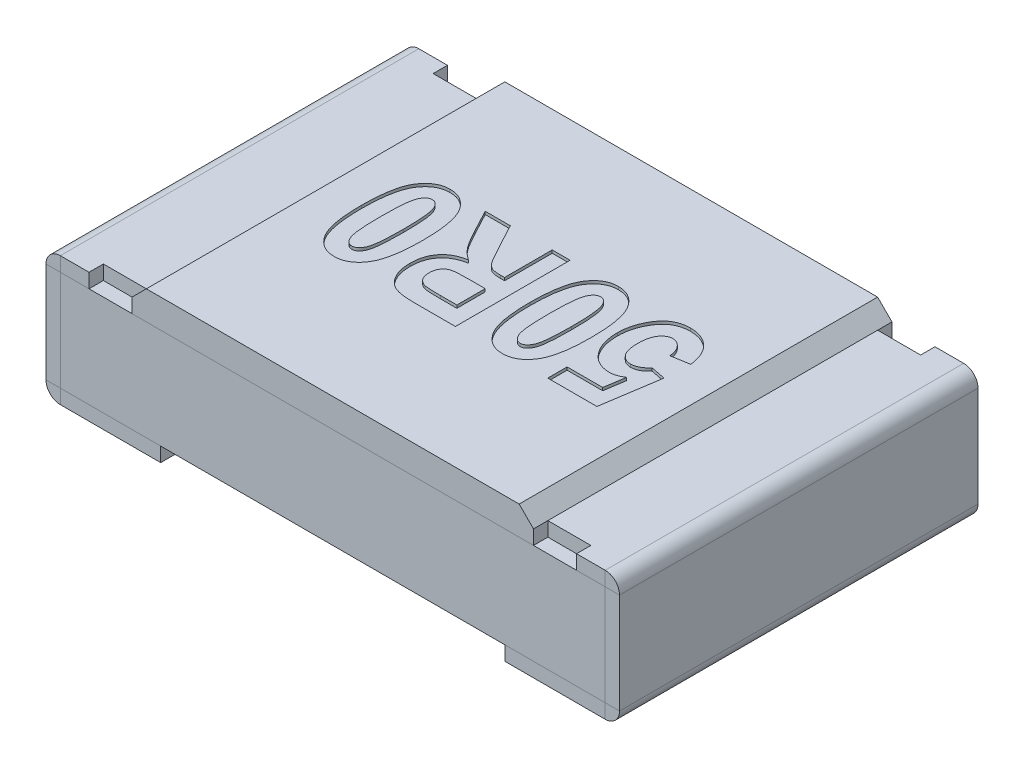
from build123d import *

# Parameters (mm, degrees)
SKETCH1_W              = 1.9
SKETCH1_H              = 1.25
BOSS_EXTRUDE1_DEPTH    = 0.35
SKETCH2_W              = 0.35
SKETCH2_H              = 1.25
BASE_FLANGE1_DEPTH     = 0.05
SM_START               = -0.625
SM_EDGE_FLANGE_1_DEPTH = 1.25
SM_EDGE_FLANGE_2_DEPTH = 1.25
SKETCH14_W             = 0.15
SKETCH14_H             = 0.05
CUT_EXTRUDE1_DEPTH     = 0.05
SKETCH17_W             = 1.4
SKETCH17_H             = 1.25
BOSS_EXTRUDE3_DEPTH    = 0.1
CHAMFER1_SIZE          = 0.05
CUT_EXTRUDE2_DEPTH     = 0.01


# Read off the part's stored shape, not the designer's step: Ребро-кромка1, Ребро-кромка2
# Sheet-metal steps are written as plain solids
with BuildPart() as part:
    # Sketch1 → Boss-Extrude1 (new body)
    with BuildSketch(Plane(origin=(0, 0.05, 0), x_dir=(1, 0, 0), z_dir=(0, 1, 0))):
        Rectangle(SKETCH1_W, SKETCH1_H)
    extrude(amount=BOSS_EXTRUDE1_DEPTH)


with BuildPart() as body_2:
    # Sketch2 → Base-Flange1 (new body)
    with BuildSketch(Plane(origin=(0, 0.05, 0), x_dir=(1, 0, 0), z_dir=(0, 1, 0))):
        with Locations((0.775, 0)):
            Rectangle(SKETCH2_W, SKETCH2_H)
    extrude(amount=-BASE_FLANGE1_DEPTH)

    # Ребро-кромка1 outline → Ребро-кромка1 (add)
    with BuildSketch(Plane.XY.offset(SM_START)):
        with BuildLine():
            Line((0.95, 0.4), (0.95, 0))
            ThreePointArc((0.95, 0), (0.985355339, 0.014644661), (1, 0.05))
            Line((1, 0.05), (1, 0.4))
            Line((1, 0.4), (0.95, 0.4))
        make_face()
    extrude(amount=SM_EDGE_FLANGE_1_DEPTH)

    # Ребро-кромка2 outline → Ребро-кромка2 (add)
    with BuildSketch(Plane.XY.offset(SM_START)):
        with BuildLine():
            Line((0.7, 0.4), (1, 0.4))
            ThreePointArc((1, 0.4), (0.985355339, 0.435355339), (0.95, 0.45))
            Line((0.95, 0.45), (0.7, 0.45))
            Line((0.7, 0.45), (0.7, 0.4))
        make_face()
    extrude(amount=SM_EDGE_FLANGE_2_DEPTH)

    # Sketch14 → Cut-Extrude1 (cut)
    with BuildSketch(Plane(origin=(0, 0.45, 0), x_dir=(1, 0, 0), z_dir=(0, 1, 0))):
        with Locations((0.775, -0.6)):
            Rectangle(SKETCH14_W, SKETCH14_H)
        with Locations((0.775, 0.6)):
            Rectangle(SKETCH14_W, SKETCH14_H)
    extrude(amount=-CUT_EXTRUDE1_DEPTH, mode=Mode.SUBTRACT)


with BuildPart() as body_3:
    # Mirror1: mirrored copy
    add(body_2.part.mirror(Plane(origin=(0, 0, 0), x_dir=(0, 0, 1), z_dir=(1, 0, 0))))


with BuildPart() as body_4:
    # Sketch17 → Boss-Extrude3 (new body)
    with BuildSketch(Plane(origin=(0, 0.4, 0), x_dir=(1, 0, 0), z_dir=(0, 1, 0))):
        Rectangle(SKETCH17_W, SKETCH17_H)
    extrude(amount=BOSS_EXTRUDE3_DEPTH)

    # Chamfer1
    chamfer1_edges = [body_4.edges().sort_by_distance(p)[0] for p in [
        (-0.7, 0.5, 0),
        (0.7, 0.5, 0),
    ]]
    chamfer(chamfer1_edges, length=CHAMFER1_SIZE)

    # Sketch18<2> → Cut-Extrude2 (cut)
    # profile 1 of 4: a face of its own
    with BuildSketch(Plane(origin=(0, 0.5, 0), x_dir=(1, 0, 0), z_dir=(0, 1, 0))):
        with BuildLine():
            Line((0.527272727, 0.096103896), (0.464935065, 0.085714286))
            add(Edge.make_bspline(
                [(0.464935065, 0.085714286), (0.464404029, 0.08993042), (0.463385582, 0.098016327), (0.460031899, 0.109328044), (0.45532733, 0.119294011), (0.449154724, 0.127597532), (0.442206893, 0.134269337), (0.434810624, 0.13924373), (0.426899303, 0.142268259), (0.421452724, 0.142661839), (0.41875, 0.142857143)],
                knots=[0, 0, 0, 0, 1.268086323, 2.431997149, 3.509560521, 4.544454025, 5.50515844, 6.375210959, 7.193740524, 8, 8, 8, 8], degree=3))
            add(Edge.make_bspline(
                [(0.41875, 0.142857143), (0.417148682, 0.1427933), (0.414001972, 0.142667844), (0.409374925, 0.141709717), (0.404892792, 0.140301963), (0.40063133, 0.138095522), (0.396490384, 0.135449466), (0.392544559, 0.132141929), (0.388838717, 0.128212088), (0.385227538, 0.123759771), (0.38200639, 0.118631701), (0.379129833, 0.112878294), (0.376721855, 0.106484491), (0.374797432, 0.099439055), (0.373238691, 0.091796533), (0.372240282, 0.083516747), (0.37156874, 0.074605143), (0.371476477, 0.068453751), (0.371428571, 0.06525974)],
                knots=[0, 0, 0, 0, 0.759915694, 1.493291328, 2.23695261, 2.984047812, 3.764651827, 4.567572245, 5.421908294, 6.327020061, 7.285992678, 8.291697758, 9.377615963, 10.524980024, 11.757348812, 13.078695297, 14.4831595, 16, 16, 16, 16], degree=3))
            add(Edge.make_bspline(
                [(0.371428571, 0.06525974), (0.371477976, 0.062255155), (0.371573788, 0.056428178), (0.372232351, 0.048001772), (0.373245247, 0.040155092), (0.374794781, 0.032943349), (0.376717763, 0.026299429), (0.379146775, 0.020292079), (0.382004988, 0.014880486), (0.385253928, 0.01004611), (0.388896956, 0.005869037), (0.392774771, 0.002207529), (0.396898992, -0.000850603), (0.401255852, -0.003437979), (0.405882881, -0.005367844), (0.41073677, -0.006734878), (0.415789557, -0.007703589), (0.419259359, -0.007762347), (0.421022727, -0.007792208)],
                knots=[0, 0, 0, 0, 1.4527188, 2.817347391, 4.084757471, 5.275362278, 6.380605517, 7.425263609, 8.402626915, 9.335182261, 10.234855237, 11.077146481, 11.909215365, 12.712502281, 13.521627502, 14.324914418, 15.14871409, 16, 16, 16, 16], degree=3))
            add(Edge.make_bspline(
                [(0.421022727, -0.007792208), (0.423273973, -0.007715286), (0.427755528, -0.007562156), (0.434381048, -0.006291246), (0.440839625, -0.004253285), (0.447128812, -0.001379947), (0.453242654, 0.002310266), (0.459181294, 0.006787381), (0.464900835, 0.012134246), (0.46845674, 0.016122951), (0.470292208, 0.018181818)],
                knots=[0, 0, 0, 0, 0.937869113, 1.867016208, 2.801624103, 3.755632097, 4.742157478, 5.773077042, 6.850519244, 8, 8, 8, 8], degree=3))
            Line((0.470292208, 0.018181818), (0.522077922, 0.007792208))
            Line((0.522077922, 0.007792208), (0.490909091, -0.194805195))
            Line((0.490909091, -0.194805195), (0.319480519, -0.194805195))
            Line((0.319480519, -0.194805195), (0.319480519, -0.127272727))
            Line((0.319480519, -0.127272727), (0.443587662, -0.127272727))
            Line((0.443587662, -0.127272727), (0.454707792, -0.055032468))
            add(Edge.make_bspline(
                [(0.454707792, -0.055032468), (0.451004373, -0.057332298), (0.443833797, -0.061785238), (0.432372216, -0.066529381), (0.420852046, -0.069532651), (0.413085487, -0.069932549), (0.409253247, -0.07012987)],
                knots=[0, 0, 0, 0, 1.075603596, 2.082587945, 3.053894447, 4, 4, 4, 4], degree=3))
            add(Edge.make_bspline(
                [(0.409253247, -0.07012987), (0.40589192, -0.070043719), (0.399298693, -0.069874733), (0.389629183, -0.068319954), (0.380294116, -0.066021692), (0.371387908, -0.06257549), (0.362837789, -0.058235723), (0.3547368, -0.052918525), (0.346905589, -0.046750579), (0.342235282, -0.041914146), (0.339853896, -0.039448052)],
                knots=[0, 0, 0, 0, 1.031196759, 2.022688252, 2.999774745, 3.977814063, 4.947386575, 5.938077482, 6.948626928, 8, 8, 8, 8], degree=3))
            add(Edge.make_bspline(
                [(0.339853896, -0.039448052), (0.336962206, -0.036126803), (0.331185175, -0.029491599), (0.323898513, -0.018417995), (0.317699294, -0.006615782), (0.312691484, 0.005969755), (0.308627341, 0.019280225), (0.305982787, 0.033440145), (0.304194913, 0.048330997), (0.303997096, 0.05851717), (0.303896104, 0.063717532)],
                knots=[0, 0, 0, 0, 0.94374017, 1.88540791, 2.835550974, 3.799054059, 4.786896658, 5.815859071, 6.884927323, 8, 8, 8, 8], degree=3))
            add(Edge.make_bspline(
                [(0.303896104, 0.063717532), (0.3039939, 0.068077365), (0.304188157, 0.076737499), (0.305615039, 0.089566861), (0.307861339, 0.102167819), (0.311162625, 0.114455722), (0.315143773, 0.126565494), (0.320392966, 0.138254931), (0.326254911, 0.149818125), (0.333090628, 0.160935278), (0.340755276, 0.171273273), (0.349327717, 0.180392394), (0.358737849, 0.18808988), (0.368949888, 0.194428113), (0.380031512, 0.199185029), (0.391806609, 0.202742948), (0.40442277, 0.204755721), (0.413088333, 0.205045958), (0.417532468, 0.205194805)],
                knots=[0, 0, 0, 0, 1.033233977, 2.052360067, 3.056176897, 4.064164219, 5.066012457, 6.07402018, 7.097977615, 8.137402717, 9.163506794, 10.143397573, 11.095939341, 12.037471958, 12.982318613, 13.946106532, 14.946660776, 16, 16, 16, 16], degree=3))
            add(Edge.make_bspline(
                [(0.417532468, 0.205194805), (0.421136239, 0.20513508), (0.428236287, 0.20501741), (0.438654966, 0.203540873), (0.448643751, 0.201416176), (0.458178119, 0.19831034), (0.467189776, 0.194195213), (0.47584476, 0.189344114), (0.483996269, 0.183536741), (0.491623392, 0.176865076), (0.49869227, 0.169413375), (0.505035357, 0.161162728), (0.510702323, 0.152198929), (0.515426624, 0.142376708), (0.5196301, 0.131909315), (0.522872767, 0.120629855), (0.525650161, 0.108670089), (0.526722607, 0.100364382), (0.527272727, 0.096103896)],
                knots=[0, 0, 0, 0, 1.008787239, 1.987483963, 2.941960961, 3.86715834, 4.789899755, 5.713107995, 6.642672678, 7.588138984, 8.547868068, 9.515110056, 10.499309066, 11.512840357, 12.564236465, 13.655396696, 14.797315056, 16, 16, 16, 16], degree=3))
        make_face()
    # profile 2 of 4: a face of its own
    with BuildSketch(Plane(origin=(0, 0.5, 0), x_dir=(1, 0, 0), z_dir=(0, 1, 0))):
        with BuildLine():
            add(Edge.make_bspline(
                [(0.166396104, -0.2), (0.162517357, -0.199857434), (0.15486375, -0.19957612), (0.143696926, -0.197413383), (0.133066146, -0.193899722), (0.123044858, -0.188915172), (0.113626938, -0.182495134), (0.104788727, -0.174678766), (0.096523296, -0.165469418), (0.08877749, -0.154784436), (0.081816853, -0.142287813), (0.075871999, -0.127754663), (0.070879301, -0.111134807), (0.066810979, -0.092430259), (0.063583701, -0.071614446), (0.061398147, -0.048685459), (0.060006663, -0.023664395), (0.059831387, -0.006279065), (0.05974026, 0.00275974)],
                knots=[0, 0, 0, 0, 0.727503026, 1.435521033, 2.125933754, 2.823035237, 3.52857293, 4.258887692, 5.031802202, 5.846339271, 6.730577678, 7.709342118, 8.787052798, 9.983216815, 11.298799232, 12.737663191, 14.303878888, 16, 16, 16, 16], degree=3))
            add(Edge.make_bspline(
                [(0.05974026, 0.00275974), (0.059831587, 0.011771451), (0.060007226, 0.029102634), (0.061395604, 0.054043203), (0.063593433, 0.076915874), (0.066794493, 0.097683332), (0.070911643, 0.116374335), (0.075833954, 0.132990657), (0.081840987, 0.147499029), (0.088769985, 0.159984707), (0.096530162, 0.170634273), (0.10470559, 0.179898955), (0.113548238, 0.187689606), (0.122948169, 0.194085522), (0.132920462, 0.199116834), (0.143487109, 0.20257983), (0.154589499, 0.204786725), (0.162191751, 0.205056917), (0.166071429, 0.205194805)],
                knots=[0, 0, 0, 0, 1.695059366, 3.259911835, 4.697127445, 6.015833273, 7.209868934, 8.295006778, 9.271397414, 10.15773515, 10.974206064, 11.745554658, 12.477603308, 13.184816065, 13.879016739, 14.571068615, 15.270769761, 16, 16, 16, 16], degree=3))
            add(Edge.make_bspline(
                [(0.166071429, 0.205194805), (0.169948166, 0.205042453), (0.177592858, 0.204742025), (0.18878376, 0.202721873), (0.199376519, 0.199148087), (0.209447857, 0.19429561), (0.218811854, 0.187842178), (0.22768016, 0.180126252), (0.235950001, 0.170995059), (0.242243926, 0.162318013), (0.246974951, 0.154643874), (0.250275534, 0.148225461), (0.253351711, 0.141273959), (0.256312839, 0.133828826), (0.258849609, 0.125744214), (0.261299278, 0.117174056), (0.263482444, 0.10807297), (0.265411661, 0.098427606), (0.267233901, 0.088263723), (0.268625076, 0.077500558), (0.269985875, 0.066254389), (0.270891486, 0.054416131), (0.271738413, 0.042080629), (0.272260378, 0.029169507), (0.272729031, 0.015750096), (0.272727865, 0.006602198), (0.272727273, 0.001948052)],
                knots=[0, 0, 0, 0, 1.088282887, 2.146027983, 3.178826917, 4.218279349, 5.273703959, 6.361191414, 7.511779163, 8.724110884, 9.365006532, 10.041034625, 10.748217649, 11.498582071, 12.288826199, 13.125555753, 14.000603745, 14.915204017, 15.88669545, 16.898559194, 17.961282966, 19.066372579, 20.230939374, 21.432180567, 22.693579123, 24, 24, 24, 24], degree=3))
            add(Edge.make_bspline(
                [(0.272727273, 0.001948052), (0.27263621, -0.007036653), (0.272461101, -0.024313857), (0.271069696, -0.049172772), (0.268885228, -0.071939776), (0.265651764, -0.092619949), (0.261572972, -0.111238668), (0.256616683, -0.12781776), (0.250628155, -0.142304698), (0.24369717, -0.154789791), (0.235937463, -0.165439494), (0.22776192, -0.174704143), (0.2189193, -0.182494803), (0.209519362, -0.188890716), (0.199547071, -0.193922029), (0.188980423, -0.197385024), (0.177878034, -0.199591919), (0.170275781, -0.199862112), (0.166396104, -0.2)],
                knots=[0, 0, 0, 0, 1.69316225, 3.255878705, 4.690734649, 6.001855936, 7.198146525, 8.280455951, 9.258690493, 10.146702072, 10.964714887, 11.737520167, 12.470951286, 13.179499609, 13.875011277, 14.568370088, 15.269392615, 16, 16, 16, 16], degree=3))
        make_face()
        with BuildLine():
            add(Edge.make_bspline(
                [(0.166233766, -0.137662338), (0.167675348, -0.137579426), (0.170549071, -0.137414146), (0.174728088, -0.136228507), (0.178704993, -0.134342522), (0.182401911, -0.131595888), (0.185777011, -0.128060086), (0.188991168, -0.123841879), (0.191981586, -0.118862777), (0.194827893, -0.112915556), (0.197448632, -0.105498009), (0.199369643, -0.096123943), (0.201281139, -0.084763042), (0.202626817, -0.071282468), (0.203882546, -0.055753966), (0.204620837, -0.03810098), (0.205117172, -0.018374202), (0.205168068, -0.004518801), (0.205194805, 0.00275974)],
                knots=[0, 0, 0, 0, 0.441218712, 0.87954774, 1.320688601, 1.783190269, 2.281372209, 2.813490262, 3.404797085, 4.057243347, 4.830526213, 5.807711728, 6.983597402, 8.359244128, 9.955404635, 11.755826947, 13.770444526, 16, 16, 16, 16], degree=3))
            add(Edge.make_bspline(
                [(0.205194805, 0.00275974), (0.205168407, 0.010038289), (0.205118252, 0.023866658), (0.20461912, 0.043566305), (0.203882964, 0.061192294), (0.202625843, 0.076720737), (0.201286624, 0.090174901), (0.199375339, 0.101483305), (0.197431747, 0.110796177), (0.194849388, 0.118173993), (0.19196589, 0.124079249), (0.188960416, 0.129038546), (0.185832388, 0.133330841), (0.18237051, 0.136787239), (0.178708916, 0.13954104), (0.17472707, 0.141422349), (0.170549326, 0.142609193), (0.167675434, 0.142774312), (0.166233766, 0.142857143)],
                knots=[0, 0, 0, 0, 2.233925394, 4.24418983, 6.048140963, 7.647429939, 9.025772927, 10.195769628, 11.166772259, 11.941570756, 12.587815933, 13.180281715, 13.720062895, 14.213314685, 14.676722855, 15.11872835, 15.557916501, 16, 16, 16, 16], degree=3))
            add(Edge.make_bspline(
                [(0.166233766, 0.142857143), (0.164765097, 0.142776027), (0.161864164, 0.142615807), (0.157655471, 0.141426978), (0.153672337, 0.139513267), (0.149905787, 0.136822484), (0.146515009, 0.13321627), (0.143234887, 0.12901585), (0.140348158, 0.123946403), (0.137450113, 0.11805017), (0.13498552, 0.110613355), (0.132998365, 0.101325268), (0.131108662, 0.090010737), (0.1297388, 0.076589538), (0.128615144, 0.061079587), (0.127838381, 0.043485936), (0.127352911, 0.023812302), (0.127300346, 0.010011149), (0.127272727, 0.00275974)],
                knots=[0, 0, 0, 0, 0.450092843, 0.889028465, 1.330779811, 1.80063996, 2.299511324, 2.844002349, 3.431866051, 4.085215219, 4.856850318, 5.827294631, 6.996618595, 8.374169049, 9.963635982, 11.76654986, 13.775658413, 16, 16, 16, 16], degree=3))
            add(Edge.make_bspline(
                [(0.127272727, 0.00275974), (0.127300576, -0.004518712), (0.12735359, -0.018373944), (0.127835721, -0.038101858), (0.128619586, -0.055749157), (0.129733275, -0.071286968), (0.131115186, -0.084760881), (0.133001939, -0.096129183), (0.134974305, -0.105474933), (0.137449096, -0.112937699), (0.140353166, -0.118828813), (0.143207703, -0.123896444), (0.146542216, -0.12802736), (0.149902743, -0.131630043), (0.153673078, -0.134317885), (0.15765528, -0.136232321), (0.161864213, -0.137420964), (0.164765113, -0.137581209), (0.166233766, -0.137662338)],
                knots=[0, 0, 0, 0, 2.227823008, 4.240875137, 6.039898439, 7.634194999, 9.008772785, 10.183744742, 11.16017094, 11.930140898, 12.582080179, 13.168675308, 13.705450879, 14.203245709, 14.672091929, 15.112890003, 15.55087843, 16, 16, 16, 16], degree=3))
        make_face(mode=Mode.SUBTRACT)
    # profile 3 of 4: a face of its own
    with BuildSketch(Plane(origin=(0, 0.5, 0), x_dir=(1, 0, 0), z_dir=(0, 1, 0))):
        with BuildLine():
            Line((0.002597403, 0.2), (0.002597403, -0.2))
            Line((0.002597403, -0.2), (-0.137824675, -0.2))
            add(Edge.make_bspline(
                [(-0.137824675, -0.2), (-0.14215393, -0.19996833), (-0.150490722, -0.199907345), (-0.162542048, -0.199458117), (-0.173607285, -0.198527935), (-0.183749009, -0.197456895), (-0.19288056, -0.195925141), (-0.20106853, -0.194062203), (-0.208301936, -0.191911761), (-0.216691453, -0.188567562), (-0.226091711, -0.183033756), (-0.23620034, -0.174547681), (-0.245193949, -0.164035571), (-0.25308557, -0.151740109), (-0.259622674, -0.137768322), (-0.26414818, -0.122301223), (-0.267118695, -0.105579048), (-0.267391508, -0.093980063), (-0.267532468, -0.087987013)],
                knots=[0, 0, 0, 0, 1.046899319, 2.016000939, 2.91522307, 3.731661062, 4.481353915, 5.152697079, 5.761194948, 6.304270959, 7.333292633, 8.382927881, 9.482183654, 10.665437712, 11.906534715, 13.198099546, 14.552293305, 16, 16, 16, 16], degree=3))
            add(Edge.make_bspline(
                [(-0.267532468, -0.087987013), (-0.267443362, -0.0841699), (-0.267269232, -0.076710435), (-0.266236906, -0.065795758), (-0.264392661, -0.055441609), (-0.261671579, -0.04569134), (-0.258389564, -0.036481368), (-0.254287432, -0.027857737), (-0.249402755, -0.019822633), (-0.243812725, -0.012310193), (-0.237415582, -0.005518698), (-0.230539234, 0.000791396), (-0.222941715, 0.006340687), (-0.214672357, 0.011088014), (-0.20589843, 0.01538107), (-0.196414306, 0.018826193), (-0.186326354, 0.021706518), (-0.179314677, 0.023026542), (-0.175730519, 0.023701299)],
                knots=[0, 0, 0, 0, 1.148717631, 2.244843165, 3.295673777, 4.308961957, 5.287674627, 6.234543683, 7.177062198, 8.113371046, 9.046666111, 9.980458233, 10.918464703, 11.870813594, 12.846745342, 13.853996914, 14.903028131, 16, 16, 16, 16], degree=3))
            add(Edge.make_bspline(
                [(-0.175730519, 0.023701299), (-0.179290705, 0.026216038), (-0.186239759, 0.031124508), (-0.195751235, 0.039288501), (-0.204498665, 0.047571459), (-0.211056564, 0.05509319), (-0.216038941, 0.061768576), (-0.220170174, 0.067602573), (-0.224664101, 0.074336377), (-0.229294474, 0.082120558), (-0.234541076, 0.090645562), (-0.239939168, 0.10018409), (-0.245724613, 0.110603628), (-0.249655823, 0.117880031), (-0.251704545, 0.121672078)],
                knots=[0, 0, 0, 0, 1.249933186, 2.439719379, 3.592669403, 4.704156299, 5.297248568, 5.982195185, 6.755146025, 7.619209292, 8.580438196, 9.627085758, 10.763372218, 12, 12, 12, 12], degree=3))
            Line((-0.251704545, 0.121672078), (-0.293506494, 0.2))
            Line((-0.293506494, 0.2), (-0.205925325, 0.2))
            Line((-0.205925325, 0.2), (-0.159577922, 0.113474026))
            add(Edge.make_bspline(
                [(-0.159577922, 0.113474026), (-0.15758333, 0.10973619), (-0.153787344, 0.102622568), (-0.148254467, 0.092537104), (-0.143223115, 0.083569185), (-0.138786331, 0.075620435), (-0.134686935, 0.068858203), (-0.131269374, 0.063041566), (-0.12817714, 0.058450359), (-0.124897251, 0.053825853), (-0.120984372, 0.049242142), (-0.11619504, 0.044631913), (-0.111220755, 0.04096958), (-0.105942423, 0.037963452), (-0.099694653, 0.036039182), (-0.092200993, 0.034732696), (-0.083219078, 0.033831746), (-0.076707035, 0.033789105), (-0.073214286, 0.033766234)],
                knots=[0, 0, 0, 0, 1.601155789, 3.047222587, 4.347276047, 5.487470144, 6.487036034, 7.33579225, 8.036276918, 8.578310902, 9.47778305, 10.309554336, 11.084651536, 11.807684935, 12.593432978, 13.540027022, 14.68058786, 16, 16, 16, 16], degree=3))
            Line((-0.073214286, 0.033766234), (-0.05974026, 0.033766234))
            Line((-0.05974026, 0.033766234), (-0.05974026, 0.2))
            Line((-0.05974026, 0.2), (0.002597403, 0.2))
        make_face()
        with BuildLine():
            Line((-0.05974026, -0.033766234), (-0.113068182, -0.033766234))
            add(Edge.make_bspline(
                [(-0.113068182, -0.033766234), (-0.116964252, -0.033789362), (-0.12437794, -0.033833373), (-0.134932435, -0.033956763), (-0.144373988, -0.034314114), (-0.152713876, -0.034665166), (-0.159936374, -0.035257478), (-0.166064879, -0.035856218), (-0.171074722, -0.03666094), (-0.176255331, -0.037780417), (-0.181668324, -0.039922942), (-0.187500302, -0.043279084), (-0.19264547, -0.047735151), (-0.197109951, -0.053130246), (-0.200902428, -0.059445906), (-0.203268992, -0.066892399), (-0.20501781, -0.075189554), (-0.205133813, -0.081076705), (-0.205194805, -0.084172078)],
                knots=[0, 0, 0, 0, 1.530902659, 2.913097779, 4.147028141, 5.243311801, 6.192393883, 6.994242862, 7.661883965, 8.185400599, 9.073837787, 9.936261241, 10.818379041, 11.73171849, 12.679847438, 13.691805882, 14.786387198, 16, 16, 16, 16], degree=3))
            add(Edge.make_bspline(
                [(-0.205194805, -0.084172078), (-0.205132863, -0.087132425), (-0.205014724, -0.09277856), (-0.203262577, -0.100752618), (-0.20087947, -0.107949361), (-0.197111393, -0.114108585), (-0.192531375, -0.119360907), (-0.187150943, -0.123695579), (-0.181116532, -0.127299044), (-0.17663181, -0.128788063), (-0.174350649, -0.129545455)],
                knots=[0, 0, 0, 0, 1.194489331, 2.27819457, 3.288780672, 4.245819423, 5.176344356, 6.094042784, 7.030531653, 8, 8, 8, 8], degree=3))
            add(Edge.make_bspline(
                [(-0.174350649, -0.129545455), (-0.173324554, -0.129772242), (-0.170882161, -0.13031206), (-0.166575619, -0.130945077), (-0.161043932, -0.131377361), (-0.15433267, -0.1317818), (-0.146430414, -0.132089016), (-0.137339394, -0.132355775), (-0.127056095, -0.132377282), (-0.119805125, -0.132436419), (-0.11599026, -0.132467532)],
                knots=[0, 0, 0, 0, 0.430892152, 1.025643899, 1.783105936, 2.70574662, 3.782977, 5.026178935, 6.435419374, 8, 8, 8, 8], degree=3))
            Line((-0.11599026, -0.132467532), (-0.05974026, -0.132467532))
            Line((-0.05974026, -0.132467532), (-0.05974026, -0.033766234))
        make_face(mode=Mode.SUBTRACT)
    # profile 4 of 4: a face of its own
    with BuildSketch(Plane(origin=(0, 0.5, 0), x_dir=(1, 0, 0), z_dir=(0, 1, 0))):
        with BuildLine():
            add(Edge.make_bspline(
                [(-0.420616883, -0.2), (-0.42449563, -0.199857434), (-0.432149237, -0.19957612), (-0.443316061, -0.197413383), (-0.453946841, -0.193899722), (-0.463968129, -0.188915172), (-0.473386049, -0.182495134), (-0.48222426, -0.174678766), (-0.490489691, -0.165469418), (-0.498235497, -0.154784436), (-0.505196134, -0.142287813), (-0.511140988, -0.127754663), (-0.516133686, -0.111134807), (-0.520202008, -0.092430259), (-0.523429286, -0.071614446), (-0.52561484, -0.048685459), (-0.527006324, -0.023664395), (-0.5271816, -0.006279065), (-0.527272727, 0.00275974)],
                knots=[0, 0, 0, 0, 0.727503026, 1.435521033, 2.125933754, 2.823035237, 3.52857293, 4.258887692, 5.031802202, 5.846339271, 6.730577678, 7.709342118, 8.787052798, 9.983216815, 11.298799232, 12.737663191, 14.303878888, 16, 16, 16, 16], degree=3))
            add(Edge.make_bspline(
                [(-0.527272727, 0.00275974), (-0.5271814, 0.011771451), (-0.527005761, 0.029102634), (-0.525617383, 0.054043203), (-0.523419554, 0.076915874), (-0.520218494, 0.097683332), (-0.516101344, 0.116374335), (-0.511179033, 0.132990657), (-0.505172, 0.147499029), (-0.498243002, 0.159984707), (-0.490482825, 0.170634273), (-0.482307397, 0.179898955), (-0.473464749, 0.187689606), (-0.464064818, 0.194085522), (-0.454092525, 0.199116834), (-0.443525878, 0.20257983), (-0.432423488, 0.204786725), (-0.424821236, 0.205056917), (-0.420941558, 0.205194805)],
                knots=[0, 0, 0, 0, 1.695059366, 3.259911835, 4.697127445, 6.015833273, 7.209868934, 8.295006778, 9.271397414, 10.15773515, 10.974206064, 11.745554658, 12.477603308, 13.184816065, 13.879016739, 14.571068615, 15.270769761, 16, 16, 16, 16], degree=3))
            add(Edge.make_bspline(
                [(-0.420941558, 0.205194805), (-0.417064821, 0.205042453), (-0.409420129, 0.204742025), (-0.398229227, 0.202721873), (-0.387636468, 0.199148087), (-0.37756513, 0.19429561), (-0.368201133, 0.187842178), (-0.359332827, 0.180126252), (-0.351062986, 0.170995059), (-0.344769061, 0.162318013), (-0.340038036, 0.154643874), (-0.336737453, 0.148225461), (-0.333661276, 0.141273959), (-0.330700148, 0.133828826), (-0.328163378, 0.125744214), (-0.325713709, 0.117174056), (-0.323530543, 0.10807297), (-0.321601326, 0.098427606), (-0.319779086, 0.088263723), (-0.318387911, 0.077500558), (-0.317027112, 0.066254389), (-0.316121501, 0.054416131), (-0.315274574, 0.042080629), (-0.314752609, 0.029169507), (-0.314283956, 0.015750096), (-0.314285122, 0.006602198), (-0.314285714, 0.001948052)],
                knots=[0, 0, 0, 0, 1.088282887, 2.146027983, 3.178826917, 4.218279349, 5.273703959, 6.361191414, 7.511779163, 8.724110884, 9.365006532, 10.041034625, 10.748217649, 11.498582071, 12.288826199, 13.125555753, 14.000603745, 14.915204017, 15.88669545, 16.898559194, 17.961282966, 19.066372579, 20.230939374, 21.432180567, 22.693579123, 24, 24, 24, 24], degree=3))
            add(Edge.make_bspline(
                [(-0.314285714, 0.001948052), (-0.314376777, -0.007036653), (-0.314551886, -0.024313857), (-0.315943291, -0.049172772), (-0.318127759, -0.071939776), (-0.321361223, -0.092619949), (-0.325440015, -0.111238668), (-0.330396304, -0.12781776), (-0.336384832, -0.142304698), (-0.343315817, -0.154789791), (-0.351075524, -0.165439494), (-0.359251067, -0.174704143), (-0.368093687, -0.182494803), (-0.377493625, -0.188890716), (-0.387465916, -0.193922029), (-0.398032564, -0.197385024), (-0.409134953, -0.199591919), (-0.416737206, -0.199862112), (-0.420616883, -0.2)],
                knots=[0, 0, 0, 0, 1.69316225, 3.255878705, 4.690734649, 6.001855936, 7.198146525, 8.280455951, 9.258690493, 10.146702072, 10.964714887, 11.737520167, 12.470951286, 13.179499609, 13.875011277, 14.568370088, 15.269392615, 16, 16, 16, 16], degree=3))
        make_face()
        with BuildLine():
            add(Edge.make_bspline(
                [(-0.420779221, -0.137662338), (-0.419337639, -0.137579426), (-0.416463916, -0.137414146), (-0.412284899, -0.136228507), (-0.408307994, -0.134342522), (-0.404611076, -0.131595888), (-0.401235976, -0.128060086), (-0.398021819, -0.123841879), (-0.395031401, -0.118862777), (-0.392185094, -0.112915556), (-0.389564355, -0.105498009), (-0.387643344, -0.096123943), (-0.385731848, -0.084763042), (-0.38438617, -0.071282468), (-0.383130441, -0.055753966), (-0.38239215, -0.03810098), (-0.381895815, -0.018374202), (-0.381844919, -0.004518801), (-0.381818182, 0.00275974)],
                knots=[0, 0, 0, 0, 0.441218712, 0.87954774, 1.320688601, 1.783190269, 2.281372209, 2.813490262, 3.404797085, 4.057243347, 4.830526213, 5.807711728, 6.983597402, 8.359244128, 9.955404635, 11.755826947, 13.770444526, 16, 16, 16, 16], degree=3))
            add(Edge.make_bspline(
                [(-0.381818182, 0.00275974), (-0.38184458, 0.010038289), (-0.381894735, 0.023866658), (-0.382393867, 0.043566305), (-0.383130023, 0.061192294), (-0.384387144, 0.076720737), (-0.385726363, 0.090174901), (-0.387637648, 0.101483305), (-0.38958124, 0.110796177), (-0.392163599, 0.118173993), (-0.395047097, 0.124079249), (-0.398052571, 0.129038546), (-0.401180599, 0.133330841), (-0.404642477, 0.136787239), (-0.408304071, 0.13954104), (-0.412285917, 0.141422349), (-0.416463661, 0.142609193), (-0.419337553, 0.142774312), (-0.420779221, 0.142857143)],
                knots=[0, 0, 0, 0, 2.233925394, 4.24418983, 6.048140963, 7.647429939, 9.025772927, 10.195769628, 11.166772259, 11.941570756, 12.587815933, 13.180281715, 13.720062895, 14.213314685, 14.676722855, 15.11872835, 15.557916501, 16, 16, 16, 16], degree=3))
            add(Edge.make_bspline(
                [(-0.420779221, 0.142857143), (-0.42224789, 0.142776027), (-0.425148823, 0.142615807), (-0.429357516, 0.141426978), (-0.43334065, 0.139513267), (-0.4371072, 0.136822484), (-0.440497978, 0.13321627), (-0.4437781, 0.12901585), (-0.446664829, 0.123946403), (-0.449562874, 0.11805017), (-0.452027467, 0.110613355), (-0.454014622, 0.101325268), (-0.455904325, 0.090010737), (-0.457274187, 0.076589538), (-0.458397843, 0.061079587), (-0.459174606, 0.043485936), (-0.459660076, 0.023812302), (-0.459712641, 0.010011149), (-0.45974026, 0.00275974)],
                knots=[0, 0, 0, 0, 0.450092843, 0.889028465, 1.330779811, 1.80063996, 2.299511324, 2.844002349, 3.431866051, 4.085215219, 4.856850318, 5.827294631, 6.996618595, 8.374169049, 9.963635982, 11.76654986, 13.775658413, 16, 16, 16, 16], degree=3))
            add(Edge.make_bspline(
                [(-0.45974026, 0.00275974), (-0.459712411, -0.004518712), (-0.459659397, -0.018373944), (-0.459177266, -0.038101858), (-0.458393401, -0.055749157), (-0.457279712, -0.071286968), (-0.455897801, -0.084760881), (-0.454011048, -0.096129183), (-0.452038682, -0.105474933), (-0.449563891, -0.112937699), (-0.446659821, -0.118828813), (-0.443805284, -0.123896444), (-0.440470771, -0.12802736), (-0.437110244, -0.131630043), (-0.433339909, -0.134317885), (-0.429357707, -0.136232321), (-0.425148774, -0.137420964), (-0.422247874, -0.137581209), (-0.420779221, -0.137662338)],
                knots=[0, 0, 0, 0, 2.227823008, 4.240875137, 6.039898439, 7.634194999, 9.008772785, 10.183744742, 11.16017094, 11.930140898, 12.582080179, 13.168675308, 13.705450879, 14.203245709, 14.672091929, 15.112890003, 15.55087843, 16, 16, 16, 16], degree=3))
        make_face(mode=Mode.SUBTRACT)
    extrude(amount=-CUT_EXTRUDE2_DEPTH, mode=Mode.SUBTRACT)


solid = Compound([part.part, body_2.part, body_3.part, body_4.part])
